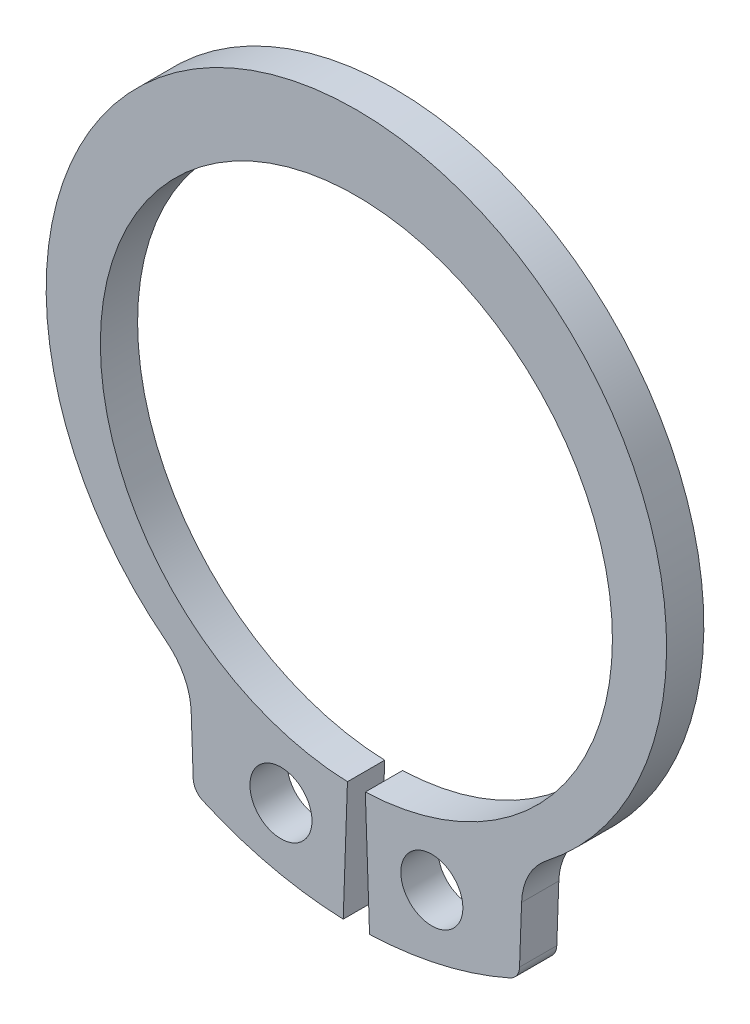
from build123d import *

# Parameters (mm, degrees)
SKETCH1_R            = 1
BOSS_EXTRUDE1_DEPTH  = 1.2
FILLET1_R            = 2.07
FILLET4_R            = 0.52
FILLET1_OF_MIRROR1_R = 2.07
FILLET4_OF_MIRROR1_R = 0.52


with BuildPart() as part:
    # Sketch1 → Boss-Extrude1 (new body)
    with BuildSketch(Plane.XY):
        with BuildLine():
            Line((0, 10.660033682), (0, 8.260033682))
            ThreePointArc((0, 8.260033682), (-8.248743485, 0.154016035), (-0.287920848, -8.234940641))
            Line((-0.287920848, -8.234940641), (-0.424287349, -12.139966318))
            ThreePointArc((-0.424287349, -12.139966318), (-2.896253939, -11.797346759), (-5.246180053, -10.95719544))
            Line((-5.246180053, -10.95719544), (-5.359136951, -7.773419995))
            ThreePointArc((-5.359136951, -7.773419995), (-9.598340525, 3.454793545), (0, 10.660033682))
        make_face()
        with Locations((-2.430824062, -9.899893105)):
            Circle(SKETCH1_R, mode=Mode.SUBTRACT)
    boss_extrude1 = extrude(amount=BOSS_EXTRUDE1_DEPTH)

    # Fillet1
    fillet1_edges = [part.edges().sort_by_distance(p)[0] for p in [
        (-5.359136951, -7.773419995, 0.6),
    ]]
    fillet(fillet1_edges, radius=FILLET1_R)

    # Fillet4
    fillet4_edges = [part.edges().sort_by_distance(p)[0] for p in [
        (-5.246180053, -10.95719544, 0.6),
    ]]
    fillet(fillet4_edges, radius=FILLET4_R)

    # Mirror1: Boss-Extrude1 across plane
    add(boss_extrude1.mirror(Plane(origin=(0, 10.660033682, 1.2), x_dir=(0, 0, 1), z_dir=(-1, 0, 0))))

    # Fillet1 of Mirror1
    fillet1_of_mirror1_edges = [part.edges().sort_by_distance(p)[0] for p in [
        (5.359136951, -7.773419995, 0.6),
    ]]
    fillet(fillet1_of_mirror1_edges, radius=FILLET1_OF_MIRROR1_R)

    # Fillet4 of Mirror1
    fillet4_of_mirror1_edges = [part.edges().sort_by_distance(p)[0] for p in [
        (5.246180053, -10.95719544, 0.6),
    ]]
    fillet(fillet4_of_mirror1_edges, radius=FILLET4_OF_MIRROR1_R)


solid = part.part
